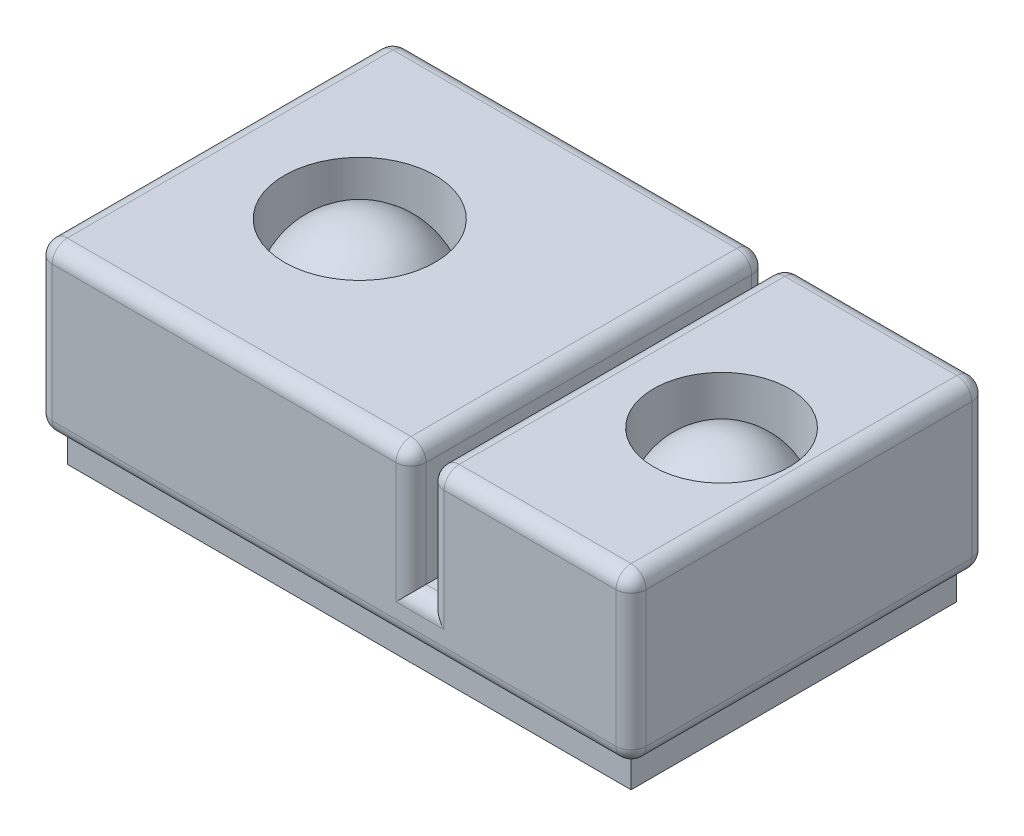
from build123d import *
from build123d.topology import SkipClean

# Parameters (mm, degrees)
SKETCH_1_W          = 3.94
SKETCH_1_H          = 2.36
BOSS_EXTRUDE1_DEPTH = 1.1
SKETCH_2_W          = 3.74
SKETCH_2_H          = 2.16
BOSS_EXTRUDE2_DEPTH = 0.2
SKETCH_3_W          = 0.72
SKETCH_3_H          = 0.6
BOSS_EXTRUDE3_DEPTH = 0.05
SKETCH_4_W          = 0.12
SKETCH_4_H          = 2.36
CUT_EXTRUDE1_DEPTH  = 0.8
FILLET1_R           = 0.1
SKETCH_5_R          = 0.5
SKETCH_5_R_2        = 0.45
CUT_EXTRUDE2_DEPTH  = 0.5


with BuildPart() as part:
    # 草图1 → Boss-Extrude1 (new body)
    with BuildSketch(Plane(origin=(0, 0, 0), x_dir=(1, 0, 0), z_dir=(0, 1, 0))):
        Rectangle(SKETCH_1_W, SKETCH_1_H)
    extrude(amount=BOSS_EXTRUDE1_DEPTH)

    # 草图2 → Boss-Extrude2 (add)
    with BuildSketch(Plane.XZ):
        Rectangle(SKETCH_2_W, SKETCH_2_H)
    extrude(amount=BOSS_EXTRUDE2_DEPTH)

    # 草图3 → Boss-Extrude3 (add)
    with BuildSketch(Plane.XZ.offset(0.2)):
        with Locations((-1.46, 0.73)):
            Rectangle(SKETCH_3_W, SKETCH_3_H)
        with Locations((-0.49, 0.73)):
            Rectangle(SKETCH_3_W, SKETCH_3_H)
        with Locations((0.48, 0.73)):
            Rectangle(SKETCH_3_W, SKETCH_3_H)
        with Locations((1.45, 0.73)):
            Rectangle(SKETCH_3_W, SKETCH_3_H)
        with Locations((-0.49, -0.72)):
            Rectangle(SKETCH_3_W, SKETCH_3_H)
        with Locations((0.48, -0.72)):
            Rectangle(SKETCH_3_W, SKETCH_3_H)
        with Locations((1.45, -0.72)):
            Rectangle(SKETCH_3_W, SKETCH_3_H)
        with Locations((-1.46, -0.72)):
            Rectangle(SKETCH_3_W, SKETCH_3_H)
    extrude(amount=BOSS_EXTRUDE3_DEPTH)

    # 草图4 → Cut-Extrude1 (cut)
    with BuildSketch(Plane(origin=(0, 1.1, 0), x_dir=(1, 0, 0), z_dir=(0, 1, 0))):
        with Locations((0.57, 0)):
            Rectangle(SKETCH_4_W, SKETCH_4_H)
    extrude(amount=-CUT_EXTRUDE1_DEPTH, mode=Mode.SUBTRACT)

    # Fillet1
    fillet1_edges = [part.edges().sort_by_distance(p)[0] for p in [
        (-1.97, 1.1, 0),
        (-0.73, 1.1, -1.18),
        (1.3, 1.1, 1.18),
        (0.63, 0.7, -1.18),
        (0.57, 0.3, 1.18),
        (0.63, 0.7, 1.18),
        (0.51, 0.7, 1.18),
        (0.57, 0.3, -1.18),
        (0.51, 0.7, -1.18),
        (0.63, 1.1, 0),
        (0.51, 1.1, 0),
        (-0.73, 1.1, 1.18),
        (1.97, 1.1, 0),
        (0, 0, 1.18),
        (-1.97, 0, 0),
        (0, 0, -1.18),
        (1.97, 0, 0),
        (1.3, 1.1, -1.18),
        (1.97, 0.55, 1.18),
        (-1.97, 0.55, 1.18),
        (-1.97, 0.55, -1.18),
        (1.97, 0.55, -1.18),
    ]]
    fillet(fillet1_edges, radius=FILLET1_R - 0.0001)  # a hair under: the kernel refuses the full size

    # 草图5 → Cut-Extrude2 (cut)
    with BuildSketch(Plane(origin=(0, 1.1, 0), x_dir=(1, 0, 0), z_dir=(0, 1, 0))):
        with Locations(Location((-1.01, 0, 0), (0, 0, 270))):
            Circle(SKETCH_5_R)
        with Locations(Location((1.39, 0, 0), (0, 0, 270))):
            Circle(SKETCH_5_R_2)
    extrude(amount=-CUT_EXTRUDE2_DEPTH, mode=Mode.SUBTRACT)

    # 草图6 → Boss-Revole1 (revolve)
    with SkipClean():  # the faces are left unmerged after this step: merging them gives an invalid solid
        with BuildSketch(Plane.XY):
            with BuildLine():
                ThreePointArc((-1.01, 1.1), (-1.363553391, 0.953553391), (-1.51, 0.6))
                Line((-1.51, 0.6), (-1.01, 0.6))
                Line((-1.01, 0.6), (-1.01, 1.1))
            make_face()
            with BuildLine():
                Line((-1.01, 1.1), (-1.01, 0.6))
                Line((-1.01, 0.6), (-0.51, 0.6))
                ThreePointArc((-0.51, 0.6), (-0.656446609, 0.953553391), (-1.01, 1.1))
            make_face()
        revolve(axis=Axis((-1.01, 0.436033652, 0), (0, 1, 0)))
    add(part.part.scale(1), mode=Mode.REPLACE)  # the faces are merged on a copy

    # 草图7 → Boss-Revole2 (revolve)
    with BuildSketch(Plane.XY):
        with BuildLine():
            Line((0.94, 0.6), (1.39, 0.6))
            Line((1.39, 0.6), (1.39, 1.05))
            ThreePointArc((1.39, 1.05), (1.071801948, 0.918198052), (0.94, 0.6))
        make_face()
    revolve(axis=Axis((1.39, 0.6, 0), (0, 1, 0)))


solid = part.part
